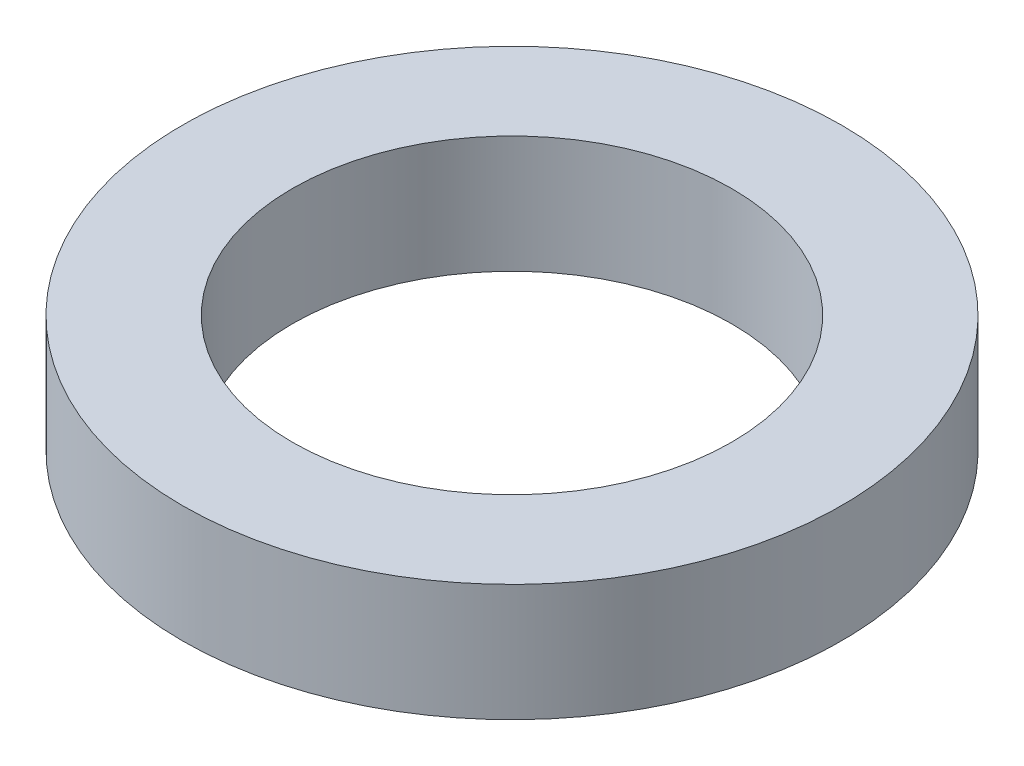
from build123d import *

# Parameters (mm, degrees)
SKETCH1_R           = 45
BOSS_EXTRUDE1_DEPTH = 16
SKETCH2_R           = 30
CUT_EXTRUDE1_DEPTH  = 66.620118866


with BuildPart() as part:
    # Sketch1 → Boss-Extrude1 (new body)
    with BuildSketch(Plane(origin=(0, 0, 0), x_dir=(1, 0, 0), z_dir=(0, 1, 0))):
        Circle(SKETCH1_R)
    extrude(amount=BOSS_EXTRUDE1_DEPTH)

    # Sketch2 → Cut-Extrude1 (cut, through all)
    with BuildSketch(Plane(origin=(0, 0, 0), x_dir=(1, 0, 0), z_dir=(0, 1, 0))):
        Circle(SKETCH2_R)
    extrude(amount=CUT_EXTRUDE1_DEPTH, mode=Mode.SUBTRACT)


solid = part.part
